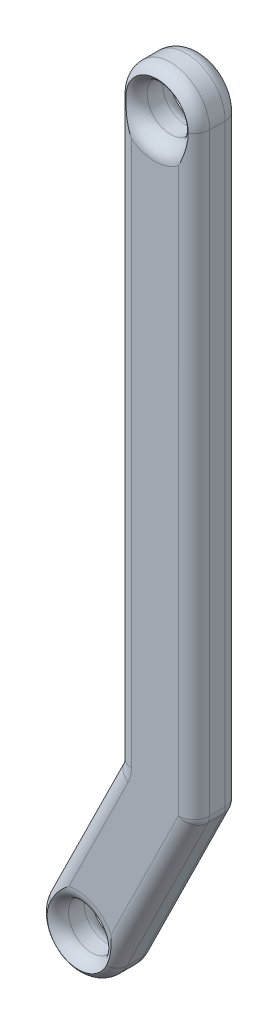
from build123d import *

# Parameters (mm, degrees)
SKETCH1_R           = 1.5
BOSS_EXTRUDE1_DEPTH = 3
FILLET1_R           = 1


with BuildPart() as part:
    # Sketch1 → Boss-Extrude1 (new body)
    with BuildSketch(Plane.XY):
        with BuildLine():
            Line((-2.5, 0), (-2.5, -37.136851725))
            Line((-2.5, -37.136851725), (-7.28143986, -46.828388088))
            ThreePointArc((-7.28143986, -46.828388088), (-6.145564068, -50.176489966), (-2.79746219, -49.040614175))
            Line((-2.79746219, -49.040614175), (2.5, -38.303148275))
            Line((2.5, -38.303148275), (2.5, 0))
            ThreePointArc((2.5, 0), (0, 2.5), (-2.5, 0))
        make_face()
        Circle(SKETCH1_R, mode=Mode.SUBTRACT)
        with Locations((-5.039451025, -47.934501132)):
            Circle(SKETCH1_R, mode=Mode.SUBTRACT)
    extrude(amount=BOSS_EXTRUDE1_DEPTH)

    # Fillet1
    # the kernel refuses this fillet: 1 mm, written as the material it adds along each edge
    with BuildSketch(Plane(origin=(-2.5, -37.136851725, 0), x_dir=(0, 1, 0), z_dir=(0, 0, 1))) as fillet1_piece_1:
        with BuildLine():
            CenterArc((FILLET1_R * 0.23325930992, FILLET1_R), FILLET1_R, 243.74, 26.26)
            Line((-FILLET1_R * 0.209185907385, FILLET1_R * 0.103204466066), (0, 0))
            Line((0, 0), (FILLET1_R * 0.23325930992, 0))
        make_face()
    extrude(amount=3)
    # the kernel refuses this fillet: 1 mm, written as the material it takes off along each edge
    with BuildSketch(Plane(origin=(1.5, -38.069888965, 2), x_dir=(0.8967955339340403, -0.44244521730487674, 0), z_dir=(0, 0, 1))) as fillet1_2_piece_1_section:
        Polygon((0, 0), (FILLET1_R, 0), (FILLET1_R, FILLET1_R * 0.23325930992), (FILLET1_R * 0.896795533934, FILLET1_R * 0.442445217305), align=None)
    fillet1_2_piece_1 = extrude(amount=FILLET1_R, mode=Mode.PRIVATE)
    fillet1_2_piece_1 = fillet1_2_piece_1 - Plane(origin=(1.5, -38.069888965, 2), x_dir=(-0.9738571594268947, 0.22716124896861223, 0), z_dir=(0, 0, 1)) * Sphere(FILLET1_R, mode=Mode.PRIVATE)
    add(fillet1_2_piece_1, mode=Mode.SUBTRACT)
    with BuildSketch(Plane(origin=(1.5, -38.069888965, 1), x_dir=(0.8967955339340403, -0.44244521730487674, 0), z_dir=(0, 0, -1))) as fillet1_2_piece_2_section:
        Polygon((0, 0), (FILLET1_R, 0), (FILLET1_R, -FILLET1_R * 0.23325930992), (FILLET1_R * 0.896795533934, -FILLET1_R * 0.442445217305), align=None)
    fillet1_2_piece_2 = extrude(amount=FILLET1_R, mode=Mode.PRIVATE)
    fillet1_2_piece_2 = fillet1_2_piece_2 - Plane(origin=(1.5, -38.069888965, 1), x_dir=(-0.9738571594268947, 0.22716124896861223, 0), z_dir=(0, 0, -1)) * Sphere(FILLET1_R, mode=Mode.PRIVATE)
    add(fillet1_2_piece_2, mode=Mode.SUBTRACT)
    with BuildSketch(Plane(origin=(0, 0, 3), x_dir=(1, 0, 0), z_dir=(0, -1, 0))) as fillet1_2_piece_3:
        with BuildLine():
            CenterArc((2.5 - FILLET1_R, -FILLET1_R), FILLET1_R, 0, 90)
            Line((2.5, -FILLET1_R), (2.5, 0))
            Line((2.5, 0), (2.5 - FILLET1_R, 0))
        make_face()
    revolve(axis=Axis((0, 0, 3), (0, 0, 1)), revolution_arc=180, mode=Mode.SUBTRACT)
    with BuildSketch(Plane(origin=(0, 0, 0), x_dir=(1, 0, 0), z_dir=(0, -1, 0))) as fillet1_2_piece_4:
        with BuildLine():
            CenterArc((2.5 - FILLET1_R, FILLET1_R), FILLET1_R, 270, 90)
            Line((2.5, FILLET1_R), (2.5, 0))
            Line((2.5, 0), (2.5 - FILLET1_R, 0))
        make_face()
    revolve(axis=Axis((0, 0, 0), (0, 0, 1)), revolution_arc=180, mode=Mode.SUBTRACT)
    with BuildSketch(Plane(origin=(-2.5, 0, 3), x_dir=(0, 0, -1), z_dir=(0, -1, 0))) as fillet1_2_piece_5:
        with BuildLine():
            CenterArc((FILLET1_R, FILLET1_R), FILLET1_R, 180, 90)
            Line((0, FILLET1_R), (0, 0))
            Line((0, 0), (FILLET1_R, 0))
        make_face()
    extrude(amount=36.903592415, mode=Mode.SUBTRACT)
    with BuildSketch(Plane(origin=(-2.5, 0, 0), x_dir=(0, 0, 1), z_dir=(0, -1, 0))) as fillet1_2_piece_6:
        with BuildLine():
            CenterArc((FILLET1_R, -FILLET1_R), FILLET1_R, 90, 90)
            Line((0, -FILLET1_R), (0, 0))
            Line((0, 0), (FILLET1_R, 0))
        make_face()
    extrude(amount=36.903592415, mode=Mode.SUBTRACT)
    with BuildSketch(Plane(origin=(-2.603204466, -37.346037633, 3), x_dir=(0.8967955339340403, -0.4424452173048767, 0), z_dir=(-0.4424452173048767, -0.8967955339340403, 0))) as fillet1_2_piece_7:
        with BuildLine():
            CenterArc((FILLET1_R, -FILLET1_R), FILLET1_R, 90, 90)
            Line((0, -FILLET1_R), (0, 0))
            Line((0, 0), (FILLET1_R, 0))
        make_face()
    extrude(amount=10.573592415, mode=Mode.SUBTRACT)
    with BuildSketch(Plane(origin=(-2.603204466, -37.346037633, 0), x_dir=(0.8967955339340403, -0.4424452173048767, 0), z_dir=(-0.4424452173048767, -0.8967955339340403, 0))) as fillet1_2_piece_8:
        with BuildLine():
            CenterArc((FILLET1_R, FILLET1_R), FILLET1_R, 180, 90)
            Line((0, FILLET1_R), (0, 0))
            Line((0, 0), (FILLET1_R, 0))
        make_face()
    extrude(amount=10.573592415, mode=Mode.SUBTRACT)
    with BuildSketch(Plane(origin=(-5.039451025, -47.934501132, 3), x_dir=(-0.8967955339340404, 0.44244521730487624, 0), z_dir=(0.44244521730487624, 0.8967955339340404, 0))) as fillet1_2_piece_9:
        with BuildLine():
            CenterArc((2.5 - FILLET1_R, -FILLET1_R), FILLET1_R, 0, 90)
            Line((2.5, -FILLET1_R), (2.5, 0))
            Line((2.5, 0), (2.5 - FILLET1_R, 0))
        make_face()
    revolve(axis=Axis((-5.039451025, -47.934501132, 3), (0, 0, 1)), revolution_arc=180, mode=Mode.SUBTRACT)
    with BuildSketch(Plane(origin=(-5.039451025, -47.934501132, 0), x_dir=(-0.8967955339340404, 0.44244521730487624, 0), z_dir=(0.44244521730487624, 0.8967955339340404, 0))) as fillet1_2_piece_10:
        with BuildLine():
            CenterArc((2.5 - FILLET1_R, FILLET1_R), FILLET1_R, 270, 90)
            Line((2.5, FILLET1_R), (2.5, 0))
            Line((2.5, 0), (2.5 - FILLET1_R, 0))
        make_face()
    revolve(axis=Axis((-5.039451025, -47.934501132, 0), (0, 0, 1)), revolution_arc=180, mode=Mode.SUBTRACT)
    with BuildSketch(Plane(origin=(-2.79746219, -49.040614175, 3), x_dir=(-0.8967955339340403, 0.44244521730487674, 0), z_dir=(0.44244521730487674, 0.8967955339340403, 0))) as fillet1_2_piece_11:
        with BuildLine():
            CenterArc((FILLET1_R, -FILLET1_R), FILLET1_R, 90, 90)
            Line((0, -FILLET1_R), (0, 0))
            Line((0, 0), (FILLET1_R, 0))
        make_face()
    extrude(amount=11.739888965, mode=Mode.SUBTRACT)
    with BuildSketch(Plane(origin=(-2.79746219, -49.040614175, 0), x_dir=(-0.8967955339340403, 0.44244521730487674, 0), z_dir=(0.44244521730487674, 0.8967955339340403, 0))) as fillet1_2_piece_12:
        with BuildLine():
            CenterArc((FILLET1_R, FILLET1_R), FILLET1_R, 180, 90)
            Line((0, FILLET1_R), (0, 0))
            Line((0, 0), (FILLET1_R, 0))
        make_face()
    extrude(amount=11.739888965, mode=Mode.SUBTRACT)
    with BuildSketch(Plane(origin=(2.5, -38.303148275, 1), x_dir=(-0.4424452173048793, -0.896795533934039, 0), z_dir=(0, 0, 1))) as fillet1_2_piece_13:
        with BuildLine():
            CenterArc((FILLET1_R * 0.23325930992, -FILLET1_R), FILLET1_R, 90, 26.26)
            Line((-FILLET1_R * 0.209185907385, -FILLET1_R * 0.103204466066), (0, 0))
            Line((0, 0), (FILLET1_R * 0.23325930992, 0))
        make_face()
    extrude(amount=1, mode=Mode.SUBTRACT)
    with BuildSketch(Plane(origin=(2.5, -38.069888965, 3), x_dir=(-1, 0, 0), z_dir=(0, 1, 0))) as fillet1_2_piece_14:
        with BuildLine():
            CenterArc((FILLET1_R, -FILLET1_R), FILLET1_R, 90, 90)
            Line((0, -FILLET1_R), (0, 0))
            Line((0, 0), (FILLET1_R, 0))
        make_face()
    extrude(amount=38.069888965, mode=Mode.SUBTRACT)
    with BuildSketch(Plane(origin=(2.5, -38.069888965, 0), x_dir=(-1, 0, 0), z_dir=(0, 1, 0))) as fillet1_2_piece_15:
        with BuildLine():
            CenterArc((FILLET1_R, FILLET1_R), FILLET1_R, 180, 90)
            Line((0, FILLET1_R), (0, 0))
            Line((0, 0), (FILLET1_R, 0))
        make_face()
    extrude(amount=38.069888965, mode=Mode.SUBTRACT)
    with BuildSketch(Plane(origin=(0, 0, 0), x_dir=(1, 0, 0), z_dir=(0, -1, 0))) as fillet1_2_piece_16:
        with BuildLine():
            CenterArc((1.5 + FILLET1_R, FILLET1_R), FILLET1_R, 180, 90)
            Line((1.5, FILLET1_R), (1.5, 0))
            Line((1.5, 0), (1.5 + FILLET1_R, 0))
        make_face()
    revolve(axis=Axis((0, 0, 0), (0, 0, 1)), mode=Mode.SUBTRACT)
    with BuildSketch(Plane(origin=(0, 0, 3), x_dir=(1, 0, 0), z_dir=(0, -1, 0))) as fillet1_2_piece_17:
        with BuildLine():
            CenterArc((1.5 + FILLET1_R, -FILLET1_R), FILLET1_R, 90, 90)
            Line((1.5, -FILLET1_R), (1.5, 0))
            Line((1.5, 0), (1.5 + FILLET1_R, 0))
        make_face()
    revolve(axis=Axis((0, 0, 3), (0, 0, 1)), mode=Mode.SUBTRACT)
    with BuildSketch(Plane(origin=(-5.039451025, -47.934501132, 0), x_dir=(1, 0, 0), z_dir=(0, -1, 0))) as fillet1_2_piece_18:
        with BuildLine():
            CenterArc((1.5 + FILLET1_R, FILLET1_R), FILLET1_R, 180, 90)
            Line((1.5, FILLET1_R), (1.5, 0))
            Line((1.5, 0), (1.5 + FILLET1_R, 0))
        make_face()
    revolve(axis=Axis((-5.039451025, -47.934501132, 0), (0, 0, 1)), mode=Mode.SUBTRACT)
    with BuildSketch(Plane(origin=(-5.039451025, -47.934501132, 3), x_dir=(1, 0, 0), z_dir=(0, -1, 0))) as fillet1_2_piece_19:
        with BuildLine():
            CenterArc((1.5 + FILLET1_R, -FILLET1_R), FILLET1_R, 90, 90)
            Line((1.5, -FILLET1_R), (1.5, 0))
            Line((1.5, 0), (1.5 + FILLET1_R, 0))
        make_face()
    revolve(axis=Axis((-5.039451025, -47.934501132, 3), (0, 0, 1)), mode=Mode.SUBTRACT)
    with BuildSketch(Plane(origin=(-3.5, -36.903592415, 0), x_dir=(1, 0, 0), z_dir=(0, 1, 0))) as fillet1_2_piece_20:
        with BuildLine():
            CenterArc((1 + FILLET1_R, -FILLET1_R), FILLET1_R, 90, 90)
            Line((1, -FILLET1_R), (1, 0))
            Line((1, 0), (1 + FILLET1_R, 0))
        make_face()
    revolve(axis=Axis((-3.5, -36.903592415, 0), (0, 0, -1)), revolution_arc=26.26, mode=Mode.SUBTRACT)
    with BuildSketch(Plane(origin=(-3.5, -36.903592415, 3), x_dir=(1, 0, 0), z_dir=(0, 1, 0))) as fillet1_2_piece_21:
        with BuildLine():
            CenterArc((1 + FILLET1_R, FILLET1_R), FILLET1_R, 180, 90)
            Line((1 + FILLET1_R, 0), (1, 0))
            Line((1, 0), (1, FILLET1_R))
        make_face()
    revolve(axis=Axis((-3.5, -36.903592415, 3), (0, 0, -1)), revolution_arc=26.26, mode=Mode.SUBTRACT)


solid = part.part
